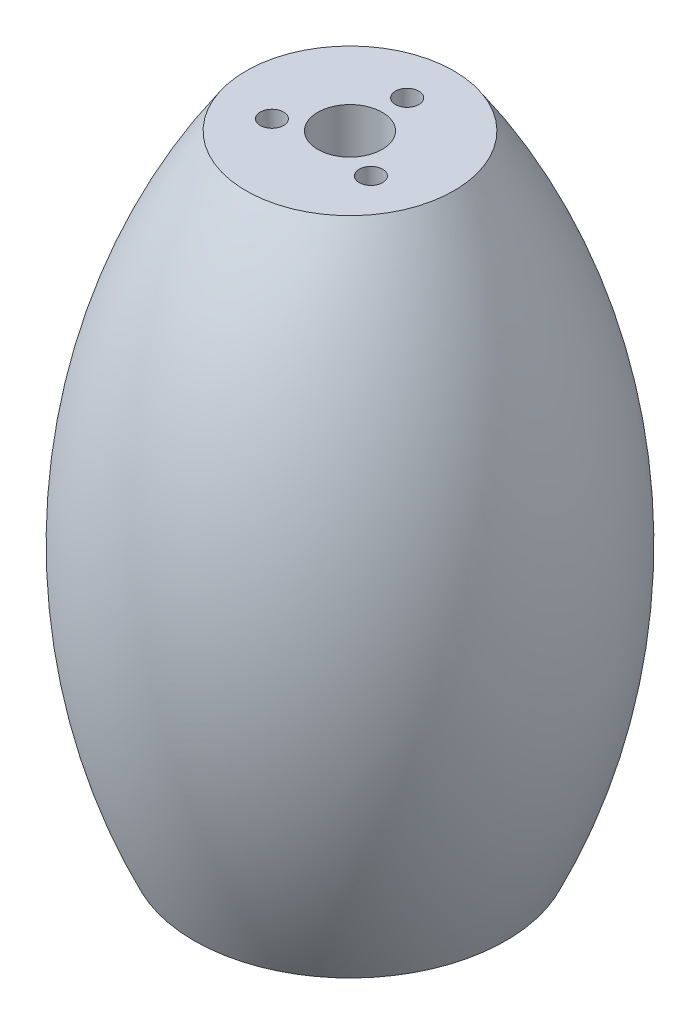
from build123d import *

# Parameters (mm, degrees)
SKETCH_2_R          = 2.25
CUT_EXTRUDE_1_DEPTH = 5
SKETCH_3_R          = 6.2
CUT_EXTRUDE_2_DEPTH = 134.492132213


with BuildPart() as part:
    # ｽｹｯﾁ1 → 回転1 (revolve)
    with BuildSketch(Plane.XY):
        with BuildLine():
            Line((-30, 0), (0, 0))
            Line((0, 0), (0, 120))
            Line((0, 120), (-20, 120))
            ThreePointArc((-20, 120), (-40.933866224, 61.327822185), (-30, 0))
        make_face()
    revolve(axis=Axis((0, 0, 0), (0, 1, 0)))

    # ｽｹｯﾁ2 → ｶｯﾄ - 押し出し1 (cut)
    with BuildSketch(Plane(origin=(0, 120, 0), x_dir=(1, 0, 0), z_dir=(0, 1, 0))):
        with Locations((0, 11)):
            Circle(SKETCH_2_R)
        with Locations((9.526279442, -5.5)):
            Circle(SKETCH_2_R)
        with Locations((-9.526279442, -5.5)):
            Circle(SKETCH_2_R)
    cut_extrude_1 = extrude(amount=-CUT_EXTRUDE_1_DEPTH, mode=Mode.SUBTRACT)

    # ﾐﾗｰ1: ｶｯﾄ - 押し出し1 across plane
    add(cut_extrude_1.mirror(Plane.ZX.offset(60)), mode=Mode.SUBTRACT)

    # ｽｹｯﾁ3 → ｶｯﾄ - 押し出し2 (cut, through all)
    with BuildSketch(Plane(origin=(0, 120, 0), x_dir=(1, 0, 0), z_dir=(0, 1, 0))):
        Circle(SKETCH_3_R)
    extrude(amount=-CUT_EXTRUDE_2_DEPTH, mode=Mode.SUBTRACT)


solid = part.part
